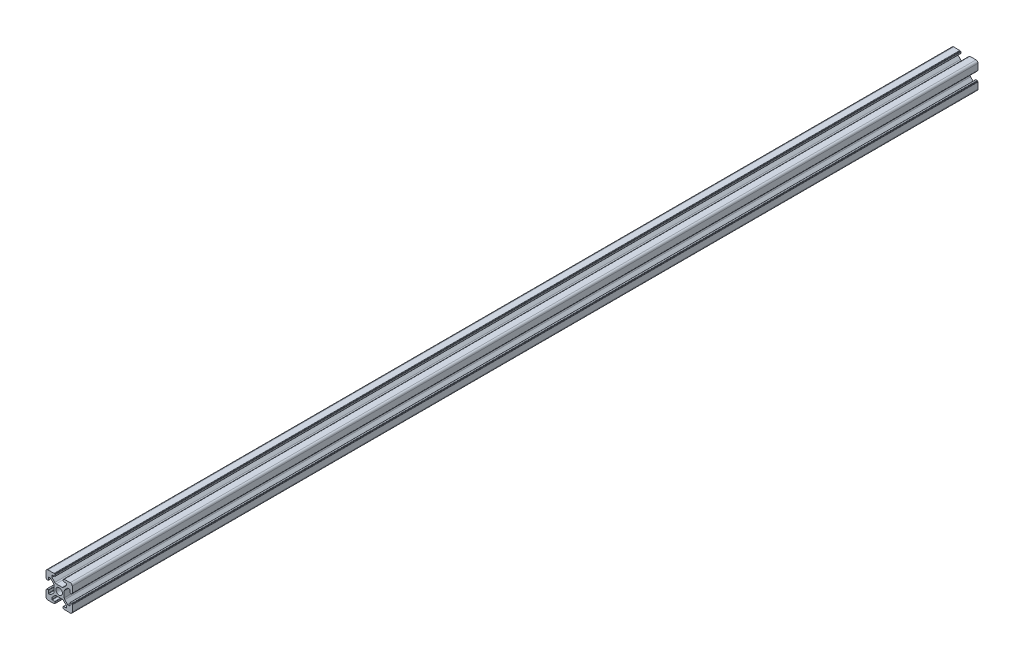
from build123d import *

# Parameters (mm, degrees)
BOSS_EXTRUDE1_DEPTH = 690
F_3DSKETCH2_R       = 2.5
CUT_EXTRUDE1_DEPTH  = 691.144961638


with BuildPart() as part:
    # Sketch1 → Boss-Extrude1 (new body)
    with BuildSketch(Plane.XY):
        with BuildLine():
            ThreePointArc((-4.339541497, 3.27832502), (-4.01438237, 2.791689997), (-3.900201668, 2.217664848))
            Line((-3.900201668, 2.217664848), (-3.900201668, -2.220777458))
            ThreePointArc((-3.900201668, -2.220777458), (-4.013982246, -2.793835668), (-4.338062619, -3.279956687))
            ThreePointArc((-4.338062619, -3.279956687), (-4.338801799, -3.280697416), (-4.339541497, -3.28143763))
            Line((-4.339541497, -3.28143763), (-6.559305445, -5.501201578))
            Line((-6.559305445, -5.501201578), (-7.918645273, -5.501201578))
            ThreePointArc((-7.918645273, -5.501201578), (-8.116635172, -5.419191476), (-8.198645273, -5.221201578))
            Line((-8.198645273, -5.221201578), (-8.198645273, -3.381201578))
            ThreePointArc((-8.198645273, -3.381201578), (-8.280655374, -3.183211679), (-8.478645273, -3.101201578))
            Line((-8.478645273, -3.101201578), (-9.418645273, -3.101201578))
            ThreePointArc((-9.418645273, -3.101201578), (-9.616635172, -3.183211679), (-9.698645273, -3.381201578))
            Line((-9.698645273, -3.381201578), (-9.698645273, -3.601201578))
            Line((-9.698645273, -3.601201578), (-9.718645273, -3.601201578))
            ThreePointArc((-9.718645273, -3.601201578), (-9.916635172, -3.683211679), (-9.998645273, -3.881201578))
            Line((-9.998645273, -3.881201578), (-9.998645273, -8.501201578))
            ThreePointArc((-9.998645273, -8.501201578), (-9.559305445, -9.561861749), (-8.498645273, -10.001201578))
            Line((-8.498645273, -10.001201578), (-3.878645273, -10.001201578))
            ThreePointArc((-3.878645273, -10.001201578), (-3.680655374, -9.919191476), (-3.598645273, -9.721201578))
            Line((-3.598645273, -9.721201578), (-3.598645273, -9.701201578))
            Line((-3.598645273, -9.701201578), (-3.378645273, -9.701201578))
            ThreePointArc((-3.378645273, -9.701201578), (-3.180655374, -9.619191476), (-3.098645273, -9.421201578))
            Line((-3.098645273, -9.421201578), (-3.098645273, -8.481201578))
            ThreePointArc((-3.098645273, -8.481201578), (-3.180655374, -8.283211679), (-3.378645273, -8.201201578))
            Line((-3.378645273, -8.201201578), (-5.218645273, -8.201201578))
            ThreePointArc((-5.218645273, -8.201201578), (-5.416635172, -8.119191476), (-5.498645273, -7.921201578))
            Line((-5.498645273, -7.921201578), (-5.498645273, -6.561861749))
            Line((-5.498645273, -6.561861749), (-3.277324929, -4.340541406))
            ThreePointArc((-3.277324929, -4.340541406), (-2.790689906, -4.015382279), (-2.216664757, -3.901201578))
            Line((-2.216664757, -3.901201578), (2.234977304, -3.899793498))
            ThreePointArc((2.234977304, -3.899793498), (2.801097117, -4.016727825), (3.280957809, -4.339061494))
            Line((3.280957809, -4.339061494), (5.502201668, -6.560305354))
            Line((5.502201668, -6.560305354), (5.502201668, -7.919645182))
            ThreePointArc((5.502201668, -7.919645182), (5.420191567, -8.117635081), (5.222201668, -8.199645182))
            Line((5.222201668, -8.199645182), (3.382201668, -8.199645182))
            ThreePointArc((3.382201668, -8.199645182), (3.18421177, -8.281655283), (3.102201668, -8.479645182))
            Line((3.102201668, -8.479645182), (3.102201668, -9.419645182))
            ThreePointArc((3.102201668, -9.419645182), (3.18421177, -9.617635081), (3.382201668, -9.699645182))
            Line((3.382201668, -9.699645182), (3.602201668, -9.699645182))
            Line((3.602201668, -9.699645182), (3.602201668, -9.719645182))
            ThreePointArc((3.602201668, -9.719645182), (3.68421177, -9.917635081), (3.882201668, -9.999645182))
            Line((3.882201668, -9.999645182), (8.502201668, -9.999645182))
            ThreePointArc((8.502201668, -9.999645182), (9.56286184, -9.560305354), (10.002201668, -8.499645182))
            Line((10.002201668, -8.499645182), (10.002201668, -3.879645182))
            ThreePointArc((10.002201668, -3.879645182), (9.920191567, -3.681655283), (9.722201668, -3.599645182))
            Line((9.722201668, -3.599645182), (9.702201668, -3.599645182))
            Line((9.702201668, -3.599645182), (9.702201668, -3.379645182))
            ThreePointArc((9.702201668, -3.379645182), (9.620191567, -3.181655283), (9.422201668, -3.099645182))
            Line((9.422201668, -3.099645182), (8.482201668, -3.099645182))
            ThreePointArc((8.482201668, -3.099645182), (8.28421177, -3.181655283), (8.202201668, -3.379645182))
            Line((8.202201668, -3.379645182), (8.202201668, -5.219645182))
            ThreePointArc((8.202201668, -5.219645182), (8.120191567, -5.417635081), (7.922201668, -5.499645182))
            Line((7.922201668, -5.499645182), (6.56286184, -5.499645182))
            Line((6.56286184, -5.499645182), (4.341541497, -3.278324838))
            ThreePointArc((4.341541497, -3.278324838), (4.01638237, -2.791689815), (3.902201668, -2.217664667))
            Line((3.902201668, -2.217664667), (3.900793589, 2.233977395))
            ThreePointArc((3.900793589, 2.233977395), (4.017727916, 2.800097207), (4.340061585, 3.2799579))
            Line((4.340061585, 3.2799579), (6.561305445, 5.501201759))
            Line((6.561305445, 5.501201759), (7.920645273, 5.501201759))
            ThreePointArc((7.920645273, 5.501201759), (8.118635172, 5.419191658), (8.200645273, 5.221201759))
            Line((8.200645273, 5.221201759), (8.200645273, 3.381201759))
            ThreePointArc((8.200645273, 3.381201759), (8.282655374, 3.183211861), (8.480645273, 3.101201759))
            Line((8.480645273, 3.101201759), (9.420645273, 3.101201759))
            ThreePointArc((9.420645273, 3.101201759), (9.618635172, 3.183211861), (9.700645273, 3.381201759))
            Line((9.700645273, 3.381201759), (9.700645273, 3.601201759))
            Line((9.700645273, 3.601201759), (9.720645273, 3.601201759))
            ThreePointArc((9.720645273, 3.601201759), (9.918635172, 3.683211861), (10.000645273, 3.881201759))
            Line((10.000645273, 3.881201759), (10.000645273, 8.501201759))
            ThreePointArc((10.000645273, 8.501201759), (9.561305445, 9.561861931), (8.500645273, 10.001201759))
            Line((8.500645273, 10.001201759), (3.880645273, 10.001201759))
            ThreePointArc((3.880645273, 10.001201759), (3.682655374, 9.919191658), (3.600645273, 9.721201759))
            Line((3.600645273, 9.721201759), (3.600645273, 9.701201759))
            Line((3.600645273, 9.701201759), (3.380645273, 9.701201759))
            ThreePointArc((3.380645273, 9.701201759), (3.182655374, 9.619191658), (3.100645273, 9.421201759))
            Line((3.100645273, 9.421201759), (3.100645273, 8.481201759))
            ThreePointArc((3.100645273, 8.481201759), (3.182655374, 8.283211861), (3.380645273, 8.201201759))
            Line((3.380645273, 8.201201759), (5.220645273, 8.201201759))
            ThreePointArc((5.220645273, 8.201201759), (5.418635172, 8.119191658), (5.500645273, 7.921201759))
            Line((5.500645273, 7.921201759), (5.500645273, 6.561861931))
            Line((5.500645273, 6.561861931), (3.279324929, 4.340541588))
            ThreePointArc((3.279324929, 4.340541588), (2.792689906, 4.015382461), (2.218664757, 3.901201759))
            Line((2.218664757, 3.901201759), (-2.232977304, 3.89979368))
            ThreePointArc((-2.232977304, 3.89979368), (-2.799097117, 4.016728006), (-3.278957809, 4.339061676))
            Line((-3.278957809, 4.339061676), (-5.500201668, 6.560305535))
            Line((-5.500201668, 6.560305535), (-5.500201668, 7.919645364))
            ThreePointArc((-5.500201668, 7.919645364), (-5.418191567, 8.117635262), (-5.220201668, 8.199645364))
            Line((-5.220201668, 8.199645364), (-3.380201668, 8.199645364))
            ThreePointArc((-3.380201668, 8.199645364), (-3.18221177, 8.281655465), (-3.100201668, 8.479645364))
            Line((-3.100201668, 8.479645364), (-3.100201668, 9.419645364))
            ThreePointArc((-3.100201668, 9.419645364), (-3.18221177, 9.617635262), (-3.380201668, 9.699645364))
            Line((-3.380201668, 9.699645364), (-3.600201668, 9.699645364))
            Line((-3.600201668, 9.699645364), (-3.600201668, 9.719645364))
            ThreePointArc((-3.600201668, 9.719645364), (-3.68221177, 9.917635262), (-3.880201668, 9.999645364))
            Line((-3.880201668, 9.999645364), (-8.500201668, 9.999645364))
            ThreePointArc((-8.500201668, 9.999645364), (-9.56086184, 9.560305535), (-10.000201668, 8.499645364))
            Line((-10.000201668, 8.499645364), (-10.000201668, 3.879645364))
            ThreePointArc((-10.000201668, 3.879645364), (-9.918191567, 3.681655465), (-9.720201668, 3.599645364))
            Line((-9.720201668, 3.599645364), (-9.700201668, 3.599645364))
            Line((-9.700201668, 3.599645364), (-9.700201668, 3.379645364))
            ThreePointArc((-9.700201668, 3.379645364), (-9.618191567, 3.181655465), (-9.420201668, 3.099645364))
            Line((-9.420201668, 3.099645364), (-8.480201668, 3.099645364))
            ThreePointArc((-8.480201668, 3.099645364), (-8.28221177, 3.181655465), (-8.200201668, 3.379645364))
            Line((-8.200201668, 3.379645364), (-8.200201668, 5.219645364))
            ThreePointArc((-8.200201668, 5.219645364), (-8.118191567, 5.417635262), (-7.920201668, 5.499645364))
            Line((-7.920201668, 5.499645364), (-6.56086184, 5.499645364))
            Line((-6.56086184, 5.499645364), (-4.339541497, 3.27832502))
        make_face()
    extrude(amount=BOSS_EXTRUDE1_DEPTH)

    # 3DSketch2 → Cut-Extrude1 (cut, through all)
    with BuildSketch(Plane.XY):
        Circle(F_3DSKETCH2_R)
    extrude(amount=CUT_EXTRUDE1_DEPTH, mode=Mode.SUBTRACT)


solid = part.part
